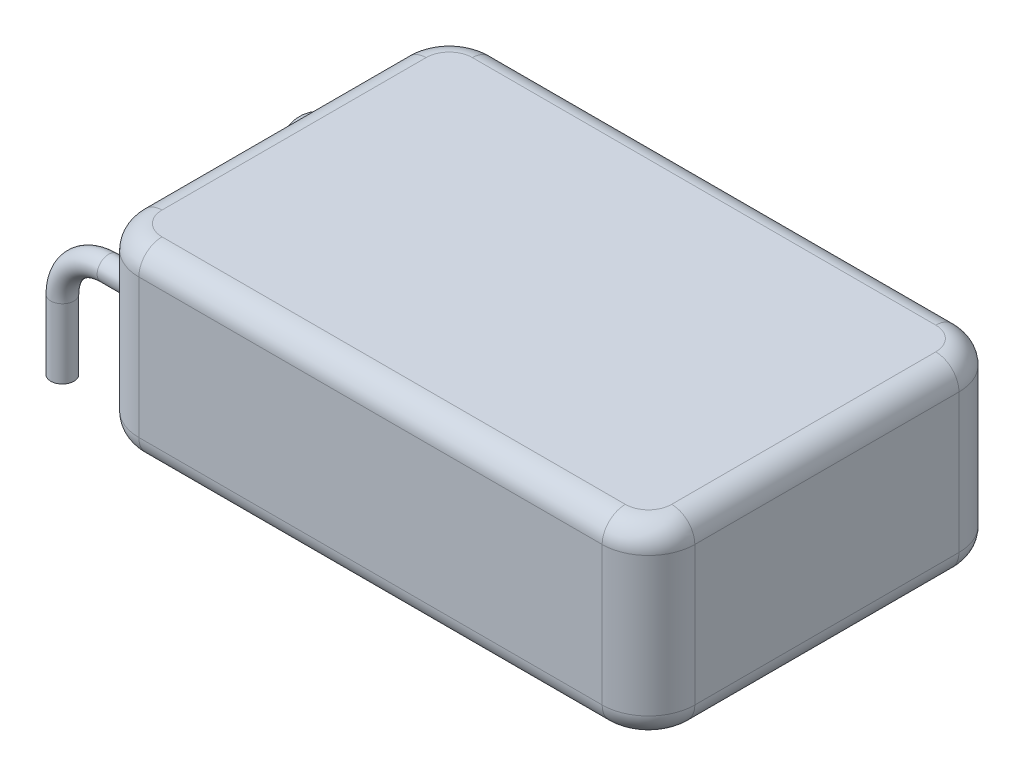
from build123d import *

# Parameters (mm, degrees)
EXTRUDE_1_DEPTH = 4
SKETCH_2_R      = 0.25
FILLET_1_R      = 0.5
FILLET_2_R      = 0.5


with BuildPart() as part:
    # Эскиз1 → Бобышка-Вытянуть1 (new body)
    with BuildSketch(Plane(origin=(0, 0, 0), x_dir=(1, 0, 0), z_dir=(0, 1, 0))):
        with BuildLine():
            Line((-5, 3.85), (5, 3.85))
            ThreePointArc((5, 3.85), (5.707106781, 3.557106781), (6, 2.85))
            Line((6, 2.85), (6, -2.85))
            ThreePointArc((6, -2.85), (5.707106781, -3.557106781), (5, -3.85))
            Line((5, -3.85), (-5, -3.85))
            ThreePointArc((-5, -3.85), (-5.707106781, -3.557106781), (-6, -2.85))
            Line((-6, -2.85), (-6, 2.85))
            ThreePointArc((-6, 2.85), (-5.707106781, 3.557106781), (-5, 3.85))
        make_face()
    extrude(amount=EXTRUDE_1_DEPTH)

    # По траектории4: sweep along a curve in space
    with BuildLine() as sweep_4_path:
        Line((-6, 2, -2.5), (-7, 2, -2.5))
        ThreePointArc((-8, 1, -2.5), (-7.707106781, 1.707106781, -2.5), (-7, 2, -2.5))
        Line((-8, 1, -2.5), (-8, -0.5, -2.5))
    # Эскиз2 → По траектории4 (sweep)
    with BuildSketch(Plane.ZY.offset(6)):
        with Locations((-2.5, 2)):
            Circle(SKETCH_2_R)
        with Locations((2.5, 2)):
            Circle(SKETCH_2_R)
    sweep(path=sweep_4_path.line)

    # Скругление1
    fillet_1_edges = [part.edges().sort_by_distance(p)[0] for p in [
        (5.707106781, 4, -3.557106781),
        (6, 4, 0),
        (5.707106781, 4, 3.557106781),
        (0, 4, 3.85),
        (-5.707106781, 4, 3.557106781),
        (-6, 4, 0),
        (-5.707106781, 4, -3.557106781),
        (0, 4, -3.85),
    ]]
    fillet(fillet_1_edges, radius=FILLET_1_R)

    # Скругление2
    fillet_2_edges = [part.edges().sort_by_distance(p)[0] for p in [
        (5.707106781, 0, -3.557106781),
        (6, 0, 0),
        (5.707106781, 0, 3.557106781),
        (0, 0, 3.85),
        (-5.707106781, 0, 3.557106781),
        (-6, 0, 0),
        (-5.707106781, 0, -3.557106781),
        (0, 0, -3.85),
    ]]
    fillet(fillet_2_edges, radius=FILLET_2_R)


solid = part.part
